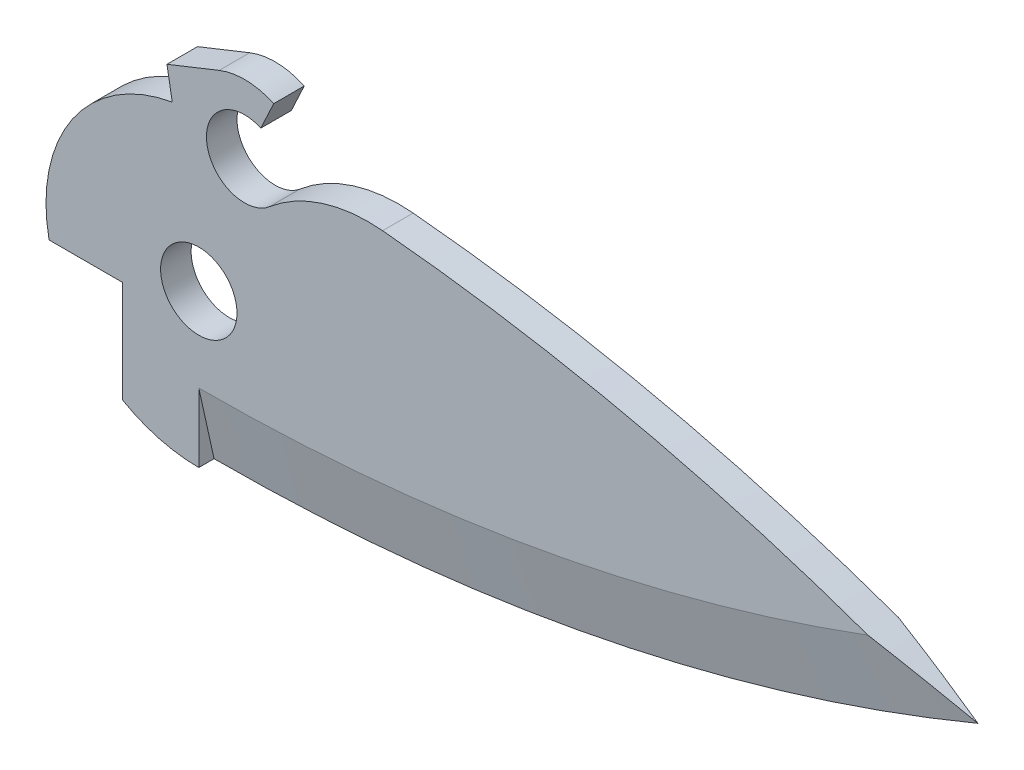
from build123d import *

# Parameters (mm, degrees)
SKICA1_R                      = 2.5
P_IDAT_VYSUNUT_M1_DEPTH       = 1
ODEBRAT_VYSUNUT_M1_DEPTH      = 52.800096623
ODEBRAT_VYSUNUT_M1_DEPTH_BACK = 52.800096623


with BuildPart() as part:
    # Skica1 → Přidat vysunutím1 (new, symmetric)
    with BuildSketch(Plane.XY):
        with BuildLine():
            Line((1.333550617, 13.180065365), (-2.083778132, 11.817693036))
            Line((-2.083778132, 11.817693036), (-1.736481777, 9.84807753))
            ThreePointArc((-1.736481777, 9.84807753), (-7.660444431, 6.427876097), (-10, 0))
            ThreePointArc((-10, 0), (-7.071067812, -7.071067812), (0, -10))
            ThreePointArc((0, -10), (25.495097568, -7.47548784), (50, 0))
            ThreePointArc((50, 0), (31.373196339, 6.157530697), (12.031913616, 9.442006531))
            ThreePointArc((12.031913616, 9.442006531), (8.089430482, 9.018973617), (4.62127636, 7.096985821))
            ThreePointArc((4.62127636, 7.096985821), (0.522628014, 8.664398983), (4.056545654, 11.265769468))
            Line((4.056545654, 11.265769468), (4.901782178, 13.078385042))
            ThreePointArc((4.901782178, 13.078385042), (3.128179964, 13.498174063), (1.333550617, 13.180065365))
        make_face()
        Circle(SKICA1_R, mode=Mode.SUBTRACT)
    extrude(amount=P_IDAT_VYSUNUT_M1_DEPTH, both=True)

    # Odebrat tažením po křivce1: sweep along a path in Skica3
    with BuildLine(Plane.XY) as odebrat_ta_en_m_po_k_ivce1_path:
        ThreePointArc((0, -10), (25.495097568, -7.47548784), (50, 0))
    # Skica2 → Odebrat tažením po křivce1 (sweep, cut)
    with BuildSketch(Plane(origin=(0, 0, 0), x_dir=(0, 0, -1), z_dir=(1, 0, 0))):
        Polygon((0, -10), (-1, -5.489291496), (-1, -10), align=None)
    odebrat_ta_en_m_po_k_ivce1 = sweep(path=odebrat_ta_en_m_po_k_ivce1_path.line, mode=Mode.SUBTRACT)

    # Zrcadlit1: Odebrat tažením po křivce1 across plane
    add(odebrat_ta_en_m_po_k_ivce1.mirror(Plane.XY), mode=Mode.SUBTRACT)

    # Skica4 → Odebrat vysunutím1 (cut, two sides: drawn at the far end of the back side and taken through both)
    with BuildSketch(Plane.XY.offset(-ODEBRAT_VYSUNUT_M1_DEPTH_BACK)):
        Polygon((-153.034153145, -2), (-13.094041856, -2), (-5, -2), (-5, -12.508943913), (-5, -152.449055202), (-204.499841768, -348.746666303), (-352.533994912, -198.297611102), align=None)
    extrude(amount=ODEBRAT_VYSUNUT_M1_DEPTH + ODEBRAT_VYSUNUT_M1_DEPTH_BACK, mode=Mode.SUBTRACT)


solid = part.part
